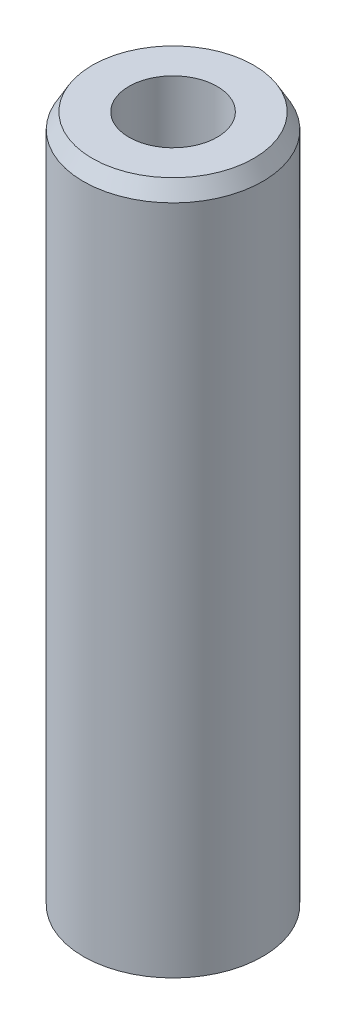
from build123d import *
from OCP.BRepFilletAPI import BRepFilletAPI_MakeChamfer

# Parameters (mm, degrees)
SKETCH1_R           = 7.5
BOSS_EXTRUDE1_DEPTH = 58.172429172
SKETCH2_R           = 3.687616223
CUT_EXTRUDE1_DEPTH  = 60.131476523
CHAMFER1_SIZE       = 1.295039319
CHAMFER1_SIZE2      = 0.747691299


with BuildPart() as part:
    # Sketch1 → Boss-Extrude1 (new body)
    with BuildSketch(Plane(origin=(0, 0, 0), x_dir=(1, 0, 0), z_dir=(0, 1, 0))):
        Circle(SKETCH1_R)
    extrude(amount=BOSS_EXTRUDE1_DEPTH)

    # Sketch2 → Cut-Extrude1 (cut, through all)
    with BuildSketch(Plane(origin=(0, 0, 0), x_dir=(1, 0, 0), z_dir=(0, 1, 0))):
        Circle(SKETCH2_R)
    extrude(amount=CUT_EXTRUDE1_DEPTH, mode=Mode.SUBTRACT)

    # Chamfer1: one chamfer whose edges measure the first distance from different faces: ONE call of the kernel's chamfer builder (chamfer() names one face for all edges)
    chamfer1_edges_1 = [part.edges().sort_by_distance(p)[0] for p in [
        (-7.5, 58.172429172, 0),
    ]]
    chamfer1_side_1 = [part.faces().sort_by_distance(p)[0] for p in [
        (-7.5, 29.086214586, 0),
    ]]
    chamfer1_edges_2 = [part.edges().sort_by_distance(p)[0] for p in [
        (-7.5, 0, 0),
    ]]
    chamfer1_side_2 = [part.faces().sort_by_distance(p)[0] for p in [
        (-7.287867966, 0, 0),
    ]]
    chamfer1 = BRepFilletAPI_MakeChamfer(part.part.solid().wrapped)
    for e in chamfer1_edges_1:
        chamfer1.Add(CHAMFER1_SIZE, CHAMFER1_SIZE2, e.wrapped, chamfer1_side_1[0].wrapped)  # the first distance lies on this face
    for e in chamfer1_edges_2:
        chamfer1.Add(CHAMFER1_SIZE, CHAMFER1_SIZE2, e.wrapped, chamfer1_side_2[0].wrapped)  # the first distance lies on this face
    add(Compound.cast(chamfer1.Shape()), mode=Mode.REPLACE)


solid = part.part
